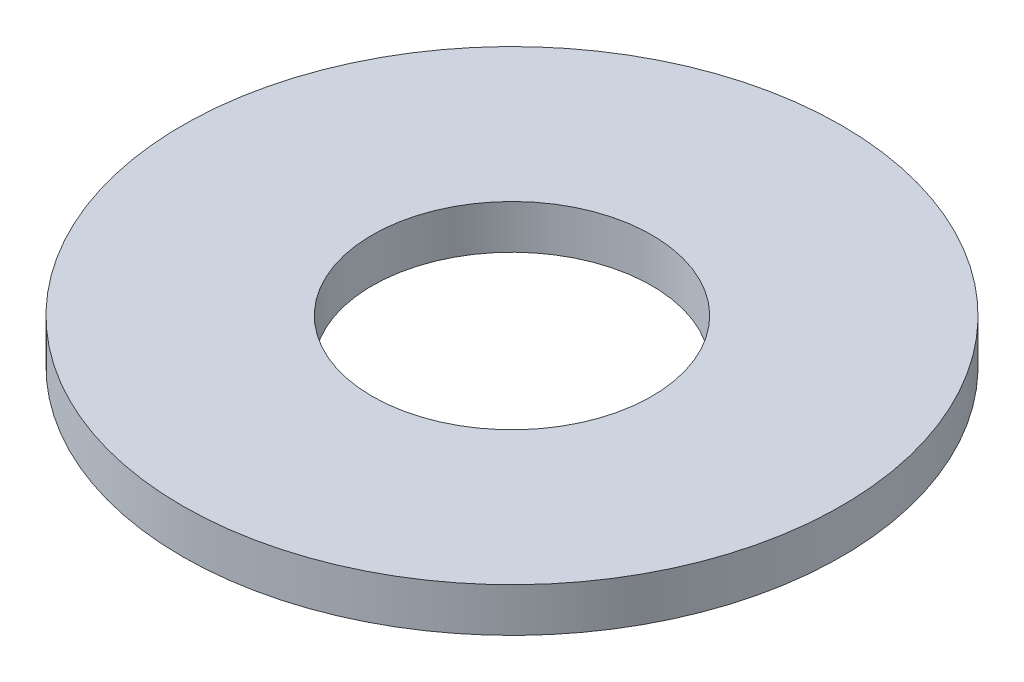
from build123d import *

# Parameters (mm, degrees)
SKETCH1_R           = 82.5
BOSS_EXTRUDE1_DEPTH = 11
SKETCH2_R           = 35
CUT_EXTRUDE1_DEPTH  = 118.19001664


with BuildPart() as part:
    # Sketch1 → Boss-Extrude1 (new body)
    with BuildSketch(Plane(origin=(0, 0, 0), x_dir=(1, 0, 0), z_dir=(0, 1, 0))):
        Circle(SKETCH1_R)
    extrude(amount=BOSS_EXTRUDE1_DEPTH)

    # Sketch2 → Cut-Extrude1 (cut, through all)
    with BuildSketch(Plane(origin=(0, 0, 0), x_dir=(1, 0, 0), z_dir=(0, 1, 0))):
        Circle(SKETCH2_R)
    extrude(amount=CUT_EXTRUDE1_DEPTH, mode=Mode.SUBTRACT)


solid = part.part
